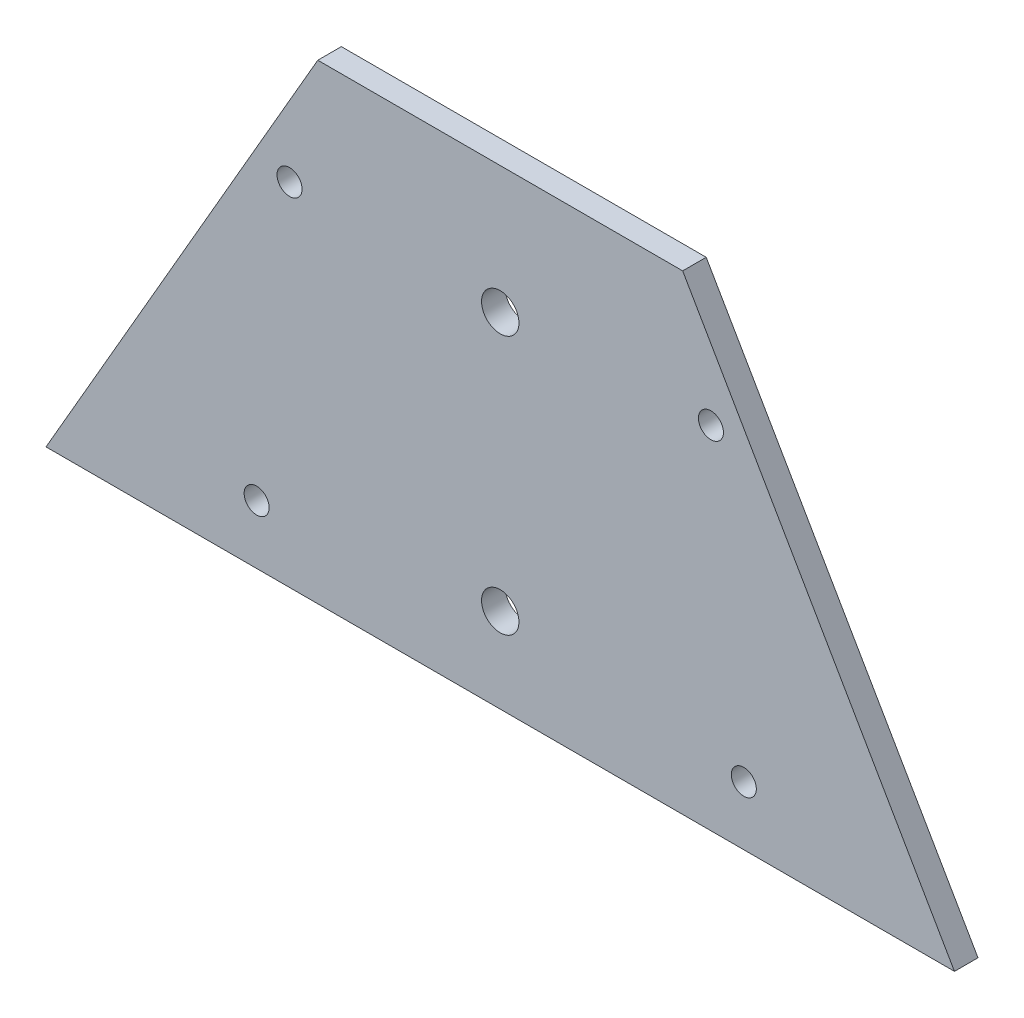
from build123d import *

# Parameters (mm, degrees)
BOSS_EXTRUDE1_DEPTH     = 6.35
F_3_8_CLEARANCE_HOLE1_D = 10.0838
F_1_4_CLEARANCE_HOLE1_D = 6.7564


with BuildPart() as part:
    # Sketch1 → Boss-Extrude1 (new body)
    with BuildSketch(Plane.XY):
        Polygon((-49.2125, 113.079516789), (49.2125, 113.079516789), (122.535984187, -13.920483211), (-122.535984187, -13.920483211), align=None)
    extrude(amount=BOSS_EXTRUDE1_DEPTH)

    # 3/8 Clearance Hole1 (through all)
    with Locations(Plane.XY.offset(6.35)):
        with Locations((0, 78.805444667), (0, 8.955444667)):
            Hole(F_3_8_CLEARANCE_HOLE1_D / 2)

    # 1/4 Clearance Hole1 (through all)
    with Locations(Plane.XY.offset(6.35)):
        with Locations((65.710283942, 1.954516789), (56.838608029, 80.820710219)):
            f_1_4_clearance_hole1 = Hole(F_1_4_CLEARANCE_HOLE1_D / 2)

    # Mirror1: 1/4 Clearance Hole1 across plane
    add(f_1_4_clearance_hole1.mirror(Plane(origin=(0, 0, 0), x_dir=(0, 0, 1), z_dir=(1, 0, 0))), mode=Mode.SUBTRACT)


solid = part.part
